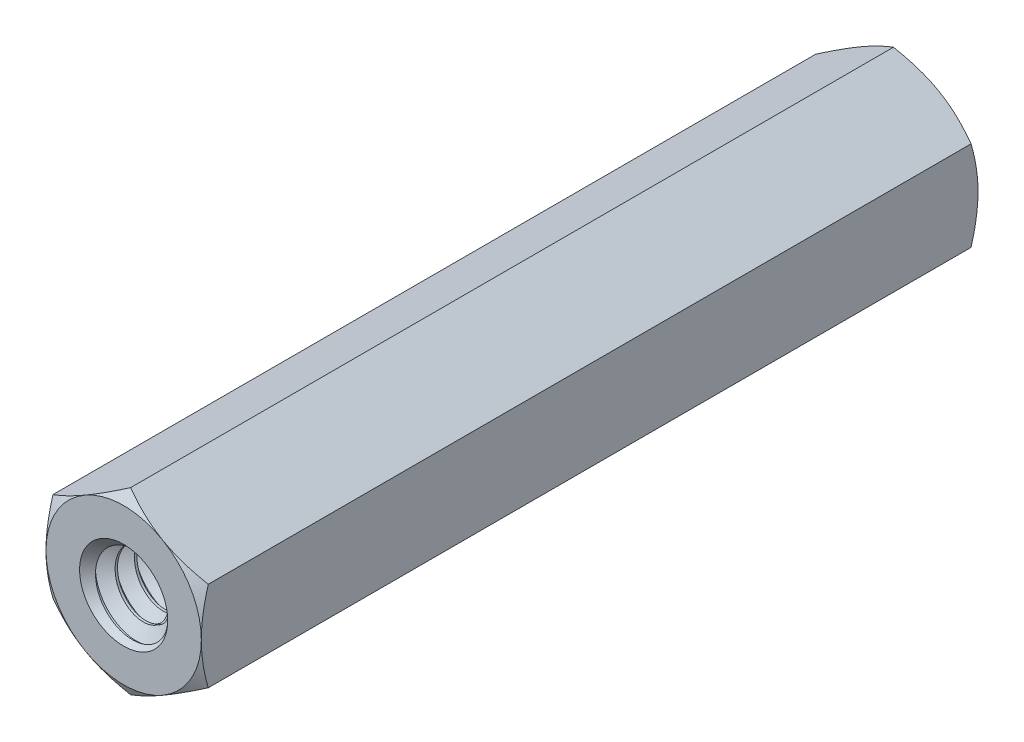
from build123d import *

# Parameters (mm, degrees)
EXTRUDE1_DEPTH          = 15.875
EXTRUDE1_DEPTH_BACK     = 15.875
SKETCH1_R               = 1.7526
SWEEP1_PITCH            = 0.79375
EXTRUDE2_DEPTH          = 33.903319039
SKETCH8_OUTSIDE_W       = 132.586
SKETCH8_OUTSIDE_H       = 133.568
SKETCH8_OUTSIDE_R       = 3.175
EXTRUDE4_DEPTH          = 33.903319039
EXTRUDE4_DRAFT          = -60
MIRROR1_COPY_1_SKETCH_W = 132.586
MIRROR1_COPY_1_SKETCH_H = 133.568
MIRROR1_COPY_1_SKETCH_R = 3.175
MIRROR1_COPY_1_DEPTH    = 33.903319039
MIRROR1_COPY_1_DRAFT    = -60
SKETCH9_W               = 12.7
SKETCH9_H               = 1.8034


with BuildPart() as part:
    # Sketch1 → Extrude1 (new, two sides: drawn at the far end of the back side and taken through both)
    with BuildSketch(Plane.XY.offset(-EXTRUDE1_DEPTH_BACK)):
        Polygon((0, 3.666174209), (-3.175, 1.833087105), (-3.175, -1.833087105), (0, -3.666174209), (3.175, -1.833087105), (3.175, 1.833087105), align=None)
        Circle(SKETCH1_R, mode=Mode.SUBTRACT)
    extrude(amount=EXTRUDE1_DEPTH + EXTRUDE1_DEPTH_BACK)

    # Sweep1: the profile of Sketch12 profile screwed along a right-hand helix of 41 turns, 8 arcs to a turn; built about Z, then put on its axis
    sweep1_z = Axis((0, 0, 0), (0, 0, 1))
    sweep1_corners = [(1.7529, 0, -0.694704455), (1.7529, 0, 0.000173205), (1.237044252, 0, -0.29765625), (1.237044252, 0, -0.396875)]
    with BuildLine(mode=Mode.PRIVATE) as sweep1_profile:
        Line(sweep1_corners[0], sweep1_corners[1])
        Line(sweep1_corners[1], sweep1_corners[2])
        Line(sweep1_corners[2], sweep1_corners[3])
        Line(sweep1_corners[3], sweep1_corners[0])
    sweep1_cap = Face(sweep1_profile.wire())
    sweep1_turn_angles = [0, 22.5, 45, 67.5, 90, 112.5, 135, 157.5, 180, 202.5, 225, 247.5, 270, 292.5, 315, 337.5, 360, 382.5, 405, 427.5, 450, 472.5, 495, 517.5, 540, 562.5, 585, 607.5, 630, 652.5, 675, 697.5, 720]
    sweep1_turn_weights = [1, 0.9238795325112867, 1, 0.9238795325112867, 1, 0.9238795325112867, 1, 0.9238795325112867, 1, 0.9238795325112867, 1, 0.9238795325112867, 1, 0.9238795325112867, 1, 0.9238795325112867, 1, 0.9238795325112867, 1, 0.9238795325112867, 1, 0.9238795325112867, 1, 0.9238795325112867, 1, 0.9238795325112867, 1, 0.9238795325112867, 1, 0.9238795325112867, 1, 0.9238795325112867, 1]
    sweep1_turn_rails = [Edge.make_bspline([Vector(p[0], p[1], 0).rotate(sweep1_z, sweep1_turn_angles[k]) / sweep1_turn_weights[k] + Vector(0, 0, p[2] + SWEEP1_PITCH * sweep1_turn_angles[k] / 360) for k in range(33)], [0, 0, 0, 1, 1, 2, 2, 3, 3, 4, 4, 5, 5, 6, 6, 7, 7, 8, 8, 9, 9, 10, 10, 11, 11, 12, 12, 13, 13, 14, 14, 15, 15, 16, 16, 16], 2, sweep1_turn_weights) for p in sweep1_corners]
    sweep1_turn_sides = [Face.make_surface_from_curves(sweep1_turn_rails[p[0]], sweep1_turn_rails[p[1]]) for p in [(0, 1), (1, 2), (2, 3), (3, 0)]]
    sweep1_last_angles = [14400, 14422.5, 14445, 14467.5, 14490, 14512.5, 14535, 14557.5, 14580, 14602.5, 14625, 14647.5, 14670, 14692.5, 14715, 14737.5, 14760]
    sweep1_last_weights = [1, 0.9238795325112867, 1, 0.9238795325112867, 1, 0.9238795325112867, 1, 0.9238795325112867, 1, 0.9238795325112867, 1, 0.9238795325112867, 1, 0.9238795325112867, 1, 0.9238795325113961, 1]
    sweep1_last_rails = [Edge.make_bspline([Vector(p[0], p[1], 0).rotate(sweep1_z, sweep1_last_angles[k]) / sweep1_last_weights[k] + Vector(0, 0, p[2] + SWEEP1_PITCH * sweep1_last_angles[k] / 360) for k in range(17)], [0, 0, 0, 1, 1, 2, 2, 3, 3, 4, 4, 5, 5, 6, 6, 7, 7, 8, 8, 8], 2, sweep1_last_weights) for p in sweep1_corners]
    sweep1_last_sides = [Face.make_surface_from_curves(sweep1_last_rails[p[0]], sweep1_last_rails[p[1]]) for p in [(0, 1), (1, 2), (2, 3), (3, 0)]]
    sweep1 = Plane(origin=(0, 0, -15.875), x_dir=(0, 1, 0), z_dir=(0, 0, 1)) * Solid(Shell([*[p.moved(Location((0, 0, 2 * SWEEP1_PITCH * i))) for i in range(20) for p in sweep1_turn_sides], *sweep1_last_sides, sweep1_cap, sweep1_cap.rotate(sweep1_z, 14760).moved(Location((0, 0, SWEEP1_PITCH * 14760 / 360)))]))
    add(sweep1)

    # Sketch6 → Extrude2 (cut, through all)
    with BuildSketch(Plane(origin=(0, 0, -15.875), x_dir=(-1, 0, 0), z_dir=(0, 0, -1))):
        Polygon((0, 3.666174209), (-3.175, 1.833087105), (-3.175, -1.833087105), (0, -3.666174209), (3.175, -1.833087105), (3.175, 1.833087105), align=None)
    extrude2 = extrude(amount=EXTRUDE2_DEPTH, mode=Mode.SUBTRACT)

    # Extrude3 cone 1 section (through the dimple's axis) → Extrude3 (revolve, cut)
    with BuildSketch(Plane(origin=(0, 0, -15.875), x_dir=(0, 1, 0), z_dir=(1, 0, 0))):
        Polygon((0, 0), (1.8034, 0), (0, 1.933909732), align=None)
    extrude3 = revolve(axis=Axis((0, 0, -15.875), (0, 0, 1)), mode=Mode.SUBTRACT)


with BuildPart() as extrude4_tool:
    # Sketch8 outside → Extrude4 (with draft: the straight prism first)
    with BuildSketch(Plane(origin=(0, 0, -15.875), x_dir=(-1, 0, 0), z_dir=(0, 0, -1))):
        Rectangle(SKETCH8_OUTSIDE_W, SKETCH8_OUTSIDE_H)
        Circle(SKETCH8_OUTSIDE_R, mode=Mode.SUBTRACT)
    extrude(amount=-EXTRUDE4_DEPTH)
    # Extrude4: the draft: its side faces are tilted about the plane it starts from
    extrude4_sides = [extrude4_tool.faces().sort_by_distance(p)[0] for p in [
        (0, -66.784, 1.07665952),
        (-66.293, 0, 1.07665952),
        (0, 66.784, 1.07665952),
        (66.293, 0, 1.07665952),
        (3.175, 0, 1.07665952),
    ]]
    draft(extrude4_sides, Plane(origin=(0, 0, -15.875), x_dir=(-1, 0, 0), z_dir=(0, 0, -1)), EXTRUDE4_DRAFT)


with BuildPart() as part_1:
    add(part.part)

    # Extrude4: cut by extrude4_tool
    add(extrude4_tool.part, mode=Mode.SUBTRACT)

    # Mirror1: Extrude2, Extrude3 across plane
    add(extrude2.mirror(Plane.XY), mode=Mode.SUBTRACT)
    add(extrude3.mirror(Plane.XY), mode=Mode.SUBTRACT)


with BuildPart() as mirror1_copy_1_tool:
    # Mirror1 copy 1 sketch → Mirror1 copy 1 (with draft: the straight prism first)
    with BuildSketch(Plane(origin=(0, 0, 15.875), x_dir=(-1, 0, 0), z_dir=(0, 0, 1))):
        Rectangle(MIRROR1_COPY_1_SKETCH_W, MIRROR1_COPY_1_SKETCH_H)
        Circle(MIRROR1_COPY_1_SKETCH_R, mode=Mode.SUBTRACT)
    extrude(amount=-MIRROR1_COPY_1_DEPTH)
    # Mirror1 copy 1: the draft: its side faces are tilted about the plane it starts from
    mirror1_copy_1_sides = [mirror1_copy_1_tool.faces().sort_by_distance(p)[0] for p in [
        (0, -66.784, -1.07665952),
        (-66.293, 0, -1.07665952),
        (0, 66.784, -1.07665952),
        (66.293, 0, -1.07665952),
        (3.175, 0, -1.07665952),
    ]]
    draft(mirror1_copy_1_sides, Plane(origin=(0, 0, 15.875), x_dir=(-1, 0, 0), z_dir=(0, 0, 1)), MIRROR1_COPY_1_DRAFT)


with BuildPart() as part_2:
    add(part_1.part)

    # Mirror1 copy 1: cut by mirror1_copy_1_tool
    add(mirror1_copy_1_tool.part, mode=Mode.SUBTRACT)

    # Sketch9 → Revolve 2 (revolve)
    with BuildSketch(Plane(origin=(0, 0, 0), x_dir=(0, 0, -1), z_dir=(1, 0, 0)), mode=Mode.PRIVATE) as revolve_2_sk:
        with Locations((0, 0.9017)):
            Rectangle(SKETCH9_W, SKETCH9_H)
    revolve(revolve_2_sk.sketch.rotate(Axis((0, 0, 15.875), (0, 0, -1)), 270), axis=Axis((0, 0, 15.875), (0, 0, -1)))


solid = part_2.part
